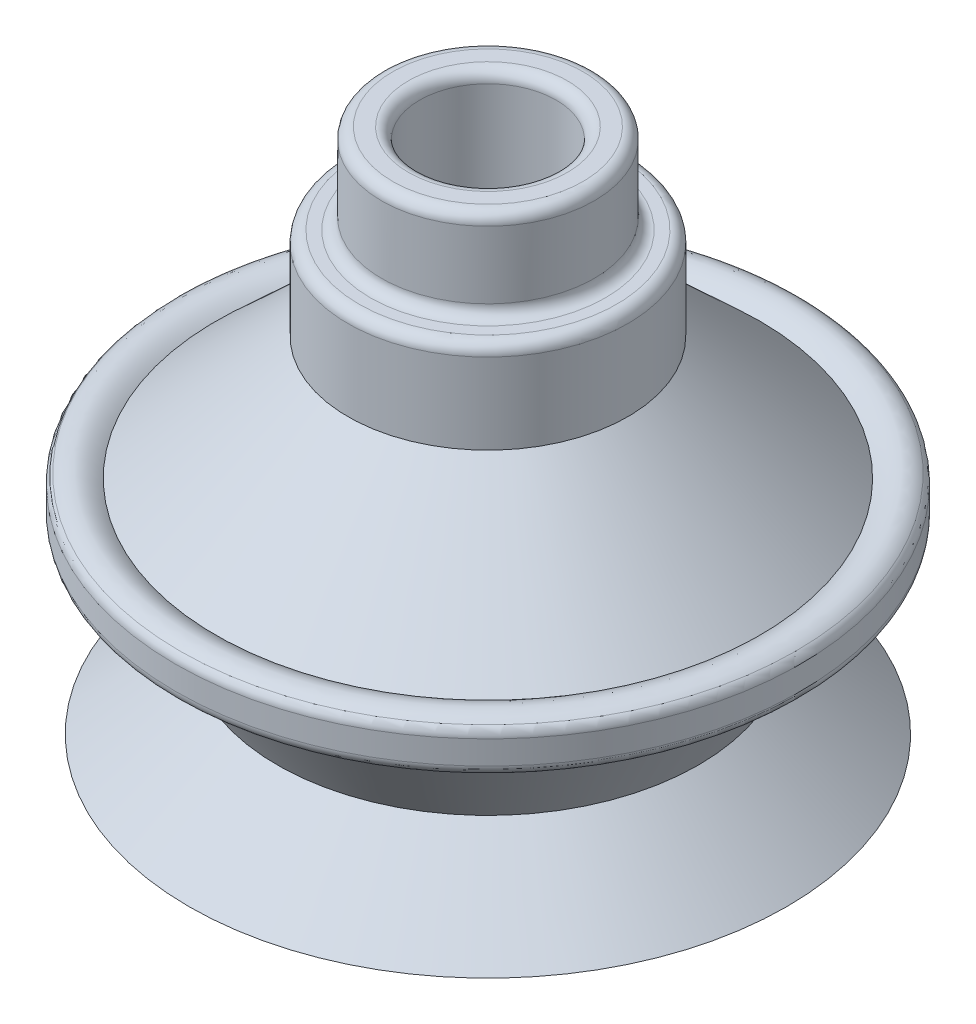
from build123d import *

# Parameters (mm, degrees)
SKETCH1_R           = 4.75
SKETCH1_R_2         = 3.05
BOSS_EXTRUDE1_DEPTH = 4
BOSS_EXTRUDE2_START = 4.1
SKETCH2_R           = 6.25
SKETCH2_R_2         = 3.05
BOSS_EXTRUDE2_DEPTH = 4.1
FILLET1_R           = 0.5
FILLET2_R           = 0.5


with BuildPart() as part:
    # Sketch1 → Boss-Extrude1 (new body)
    with BuildSketch(Plane(origin=(0, 0, 0), x_dir=(1, 0, 0), z_dir=(0, 1, 0))):
        Circle(SKETCH1_R)
        Circle(SKETCH1_R_2, mode=Mode.SUBTRACT)
    extrude(amount=BOSS_EXTRUDE1_DEPTH)

    # Sketch2 → Boss-Extrude2 (add)
    with BuildSketch(Plane.XZ.offset(BOSS_EXTRUDE2_START)):
        Circle(SKETCH2_R)
        Circle(SKETCH2_R_2, mode=Mode.SUBTRACT)
    extrude(amount=-BOSS_EXTRUDE2_DEPTH)

    # Sketch5 → Revolve1 (revolve)
    with BuildSketch(Plane.XY):
        Polygon((3.05, -4.1), (11.15, -9.6), (12.15, -9.6), (6.25, -4.1), align=None)
    revolve(axis=Axis((0, -9.6, 0), (0, 1, 0)))

    # Sketch6 → Revolve2 (revolve)
    with BuildSketch(Plane.XY):
        with BuildLine():
            Line((11.15, -9.6), (11.15, -11.1))
            Line((11.15, -11.1), (12.242757674, -11.1))
            add(Edge.make_bspline(
                [(13.95, -11.1), (13.21399381, -11.861040997), (12.242757674, -11.1)],
                knots=[0, 0, 0, 1, 1, 1], degree=2))
            Line((13.95, -11.1), (13.95, -9.6))
            add(Edge.make_bspline(
                [(12.15, -9.6), (13.182149792, -8.805854321), (13.95, -9.6)],
                knots=[0, 0, 0, 1, 1, 1], degree=2))
            Line((12.15, -9.6), (11.15, -9.6))
        make_face()
    revolve(axis=Axis((0, -9.6, 0), (0, 1, 0)))

    # Fillet1
    fillet1_edges = [part.edges().sort_by_distance(p)[0] for p in [
        (-6.25, 0, 0),
        (-4.75, 0, 0),
        (-3.05, 4, 0),
        (-4.75, 4, 0),
    ]]
    fillet(fillet1_edges, radius=FILLET1_R)

    # Fillet2
    fillet2_edges = [part.edges().sort_by_distance(p)[0] for p in [
        (-13.95, -9.6, 0),
        (-13.95, -11.1, 0),
    ]]
    fillet(fillet2_edges, radius=FILLET2_R)


with BuildPart() as body_2:
    # Sketch8 → Revolve3 (revolve)
    with BuildSketch(Plane.XY):
        Polygon((11.15, -11.480520499), (9.1, -16), (9.4, -16), (12.2427575, -11.480520499), align=None)
    revolve(axis=Axis((0, -11.480520499, 0), (0, 1, 0)))

    # Sketch9 → Revolve4 (revolve)
    with BuildSketch(Plane.XY):
        Polygon((9.4, -16), (13.35, -19.5), (12.75, -19.5), (9.1, -16), align=None)
    revolve(axis=Axis((0, -16, 0), (0, -1, 0)))


solid = Compound([part.part, body_2.part])
